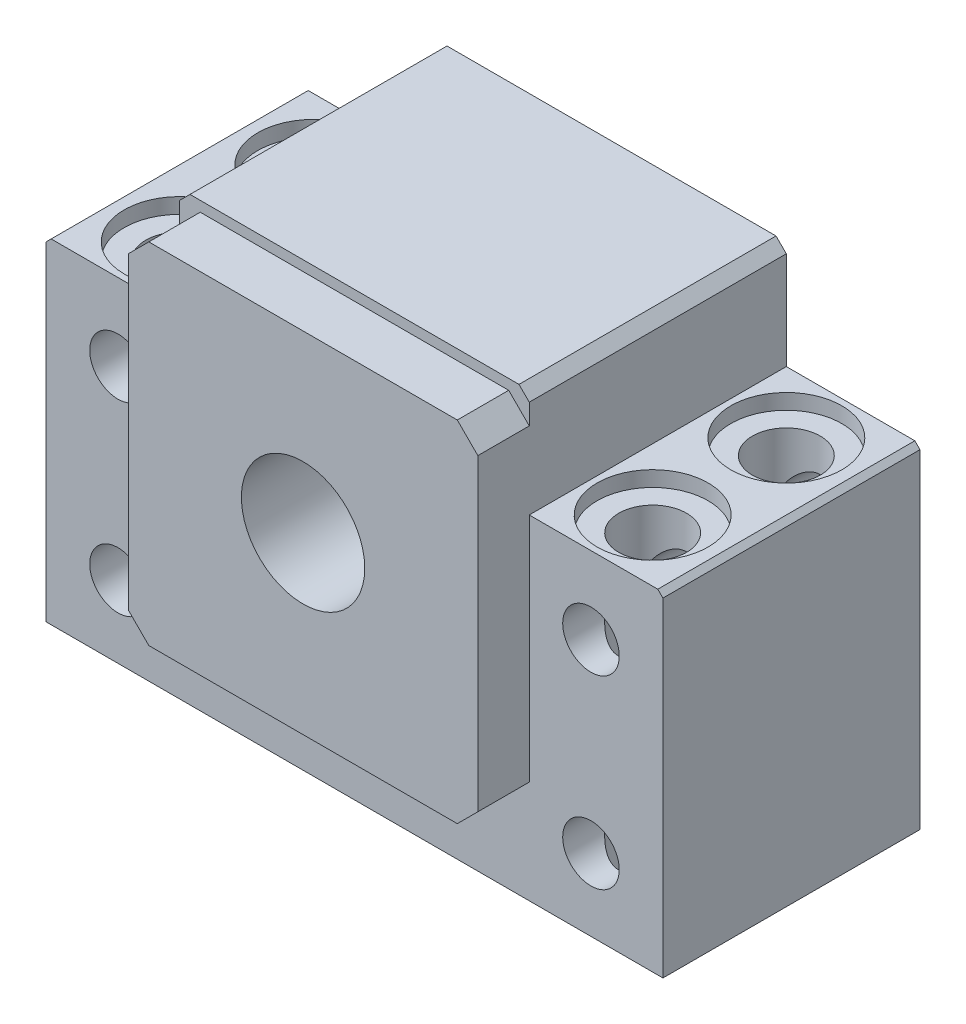
from build123d import *

# Parameters (mm, degrees)
SKETCH_1_R          = 6
SKETCH_1_R_2        = 2.75
EXTRUDE_1_DEPTH     = 25
EXTRUDE_START       = 5
SKETCH_2_R          = 6
EXTRUDE_2_DEPTH     = 5
CUT_EXTRUDE_START   = 7.5
SKETCH_3_R          = 3.3
CUT_EXTRUDE_1_DEPTH = 54.868092477
SKETCH_4_R          = 5.4
CUT_EXTRUDE_2_DEPTH = 1.5


with BuildPart() as part:
    # Эскиз1 → Бобышка-Вытянуть1 (new body)
    with BuildSketch(Plane.XY):
        Polygon((-30, 7), (-30, -25), (30, -25), (30, 7), (29.5, 7.5), (17, 7.5), (17, 17), (16, 18), (-16, 18), (-17, 17), (-17, 7.5), (-29.5, 7.5), align=None)
        Circle(SKETCH_1_R, mode=Mode.SUBTRACT)
        with Locations((-23, 0)):
            Circle(SKETCH_1_R_2, mode=Mode.SUBTRACT)
        with Locations((-23, -18)):
            Circle(SKETCH_1_R_2, mode=Mode.SUBTRACT)
        with Locations((23, -18)):
            Circle(SKETCH_1_R_2, mode=Mode.SUBTRACT)
        with Locations((23, 0)):
            Circle(SKETCH_1_R_2, mode=Mode.SUBTRACT)
    extrude(amount=-EXTRUDE_1_DEPTH)

    # Эскиз2 → Бобышка-Вытянуть2 (add)
    with BuildSketch(Plane.XY.offset(EXTRUDE_START)):
        Polygon((-17, 15), (-15, 17), (15, 17), (17, 15), (17, -15), (15, -17), (-15, -17), (-17, -15), align=None)
        Circle(SKETCH_2_R, mode=Mode.SUBTRACT)
    extrude(amount=-EXTRUDE_2_DEPTH)

    # Эскиз3 → Вырез-Вытянуть1 (cut, through all)
    with BuildSketch(Plane(origin=(0, 0, 0), x_dir=(1, 0, 0), z_dir=(0, 1, 0)).offset(CUT_EXTRUDE_START)):
        with Locations((-23, 19)):
            Circle(SKETCH_3_R)
        with Locations((-23, 6)):
            Circle(SKETCH_3_R)
        with Locations((23, 6)):
            Circle(SKETCH_3_R)
        with Locations((23, 19)):
            Circle(SKETCH_3_R)
    extrude(amount=-CUT_EXTRUDE_1_DEPTH, mode=Mode.SUBTRACT)

    # Эскиз4 → Вырез-Вытянуть2 (cut)
    with BuildSketch(Plane(origin=(0, 0, 0), x_dir=(1, 0, 0), z_dir=(0, 1, 0)).offset(CUT_EXTRUDE_START)):
        with Locations((-23, 19)):
            Circle(SKETCH_4_R)
        with Locations((-23, 6)):
            Circle(SKETCH_4_R)
        with Locations((23, 6)):
            Circle(SKETCH_4_R)
        with Locations((23, 19)):
            Circle(SKETCH_4_R)
    extrude(amount=-CUT_EXTRUDE_2_DEPTH, mode=Mode.SUBTRACT)


solid = part.part
